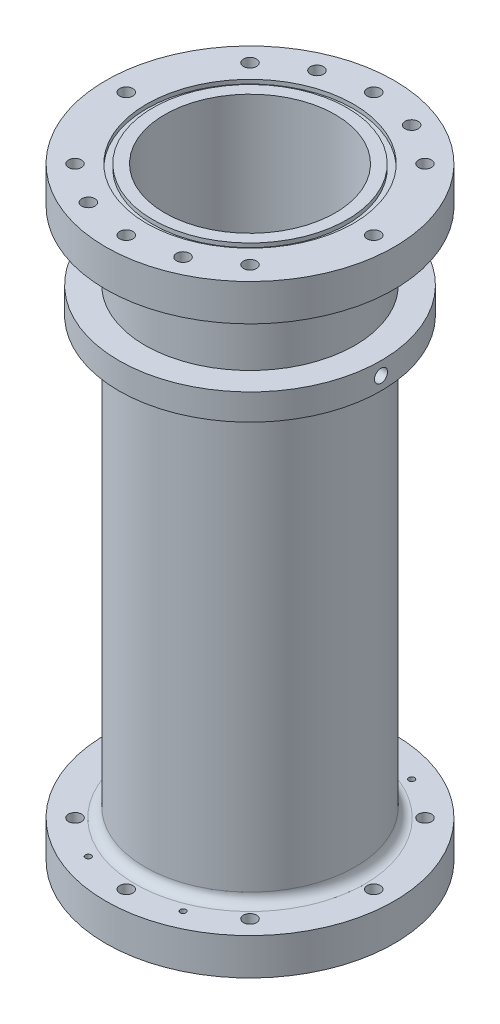
from build123d import *

# Parameters (mm, degrees)
SKETCH2_R               = 50.8
SKETCH2_R_2             = 41.275
BASE_CYLINDER_DEPTH     = 292.1
SKETCH3_R               = 69.85
SKETCH3_R_2             = 41.275
AFT_FLANGE_DEPTH        = 17.78
FORWARD_START           = -17.78
SKETCH4_R               = 69.85
SKETCH4_R_2             = 41.275
FORWARD_FLANGE_DEPTH    = 17.78
SKETCH6_R               = 50.0761
SKETCH6_R_2             = 47.0027
O_RING_SLOT_1_DEPTH     = 1.9812
O_RING_START            = -1.9812
SKETCH7_R               = 50.0761
SKETCH7_R_2             = 47.0027
O_RING_SLOT_2_DEPTH     = 1.9812
CUT_EXTRUDE4_DEPTH      = 309.351187771
CUT_EXTRUDE4_DEPTH_BACK = 309.351187771
SKETCH8_R               = 3.175
FILLET1_R               = 4.7625
SKETCH9_R               = 3.175
CUT_EXTRUDE5_DEPTH      = 7.62
CUT_EXTRUDE6_START      = -7.62
SKETCH10_R              = 3.175
CUT_EXTRUDE6_DEPTH      = 7.62
CUT_EXTRUDE7_REACH      = 303.143
SKETCH11_R              = 1.4097
CUT_EXTRUDE8_REACH      = 303.143
SKETCH12_R              = 1.4097
SKETCH14_R              = 63.5
SKETCH14_R_2            = 50.8
BOSS_EXTRUDE1_DEPTH     = 12.7
SKETCH16_R              = 3.175
CUT_EXTRUDE10_DEPTH     = 12.7
CUT_EXTRUDE11_START     = -12.7
SKETCH17_R              = 3.175
CUT_EXTRUDE11_DEPTH     = 12.7


with BuildPart() as part:
    # Sketch2 → Base Cylinder (new body)
    with BuildSketch(Plane(origin=(0, 0, 0), x_dir=(1, 0, 0), z_dir=(0, 1, 0))):
        Circle(SKETCH2_R)
        Circle(SKETCH2_R_2, mode=Mode.SUBTRACT)
    extrude(amount=BASE_CYLINDER_DEPTH)

    # Sketch3 → Aft Flange (add)
    with BuildSketch(Plane.XZ):
        Circle(SKETCH3_R)
        Circle(SKETCH3_R_2, mode=Mode.SUBTRACT)
    extrude(amount=-AFT_FLANGE_DEPTH)

    # Sketch4 → Forward Flange (add)
    with BuildSketch(Plane(origin=(0, 292.1, 0), x_dir=(1, 0, 0), z_dir=(0, 1, 0)).offset(FORWARD_START)):
        Circle(SKETCH4_R)
        Circle(SKETCH4_R_2, mode=Mode.SUBTRACT)
    extrude(amount=FORWARD_FLANGE_DEPTH)

    # Sketch6 → O-Ring Slot 1 (cut)
    with BuildSketch(Plane.XZ):
        Circle(SKETCH6_R)
        Circle(SKETCH6_R_2, mode=Mode.SUBTRACT)
    extrude(amount=-O_RING_SLOT_1_DEPTH, mode=Mode.SUBTRACT)

    # Sketch7 → O-Ring Slot 2 (cut)
    with BuildSketch(Plane(origin=(0, 292.1, 0), x_dir=(1, 0, 0), z_dir=(0, 1, 0)).offset(O_RING_START)):
        Circle(SKETCH7_R)
        Circle(SKETCH7_R_2, mode=Mode.SUBTRACT)
    extrude(amount=O_RING_SLOT_2_DEPTH, mode=Mode.SUBTRACT)

    # Sketch8 → Cut-Extrude4 (cut, two sides: drawn at the far end of the back side and taken through both)
    with BuildSketch(Plane.XZ.offset(-CUT_EXTRUDE4_DEPTH_BACK)):
        with Locations((-59.9186, 0)):
            Circle(SKETCH8_R)
        with Locations((-42.368848379, 42.368848379)):
            Circle(SKETCH8_R)
        with Locations((0, 59.9186)):
            Circle(SKETCH8_R)
        with Locations((42.368848379, 42.368848379)):
            Circle(SKETCH8_R)
        with Locations((59.9186, 0)):
            Circle(SKETCH8_R)
        with Locations((42.368848379, -42.368848379)):
            Circle(SKETCH8_R)
        with Locations((0, -59.9186)):
            Circle(SKETCH8_R)
        with Locations((-42.368848379, -42.368848379)):
            Circle(SKETCH8_R)
    extrude(amount=CUT_EXTRUDE4_DEPTH + CUT_EXTRUDE4_DEPTH_BACK, mode=Mode.SUBTRACT)

    # Fillet1
    fillet1_edges = [part.edges().sort_by_distance(p)[0] for p in [
        (-50.8, 17.78, 0),
        (-50.8, 274.32, 0),
    ]]
    fillet(fillet1_edges, radius=FILLET1_R)

    # Sketch9 → Cut-Extrude5 (cut)
    with BuildSketch(Plane(origin=(0, 292.1, 0), x_dir=(1, 0, 0), z_dir=(0, 1, 0))):
        with Locations((-22.929855511, 55.357568157)):
            Circle(SKETCH9_R)
        with Locations((22.929855511, -55.357568157)):
            Circle(SKETCH9_R)
        with Locations((22.929855511, 55.357568157)):
            Circle(SKETCH9_R)
        with Locations((-22.929855511, -55.357568157)):
            Circle(SKETCH9_R)
    extrude(amount=-CUT_EXTRUDE5_DEPTH, mode=Mode.SUBTRACT)

    # Sketch10 → Cut-Extrude6 (cut)
    with BuildSketch(Plane.XZ.offset(CUT_EXTRUDE6_START)):
        with Locations((-22.929855511, 55.357568157)):
            Circle(SKETCH10_R)
        with Locations((22.929855511, -55.357568157)):
            Circle(SKETCH10_R)
        with Locations((22.929855511, 55.357568157)):
            Circle(SKETCH10_R)
        with Locations((-22.929855511, -55.357568157)):
            Circle(SKETCH10_R)
    extrude(amount=CUT_EXTRUDE6_DEPTH, mode=Mode.SUBTRACT)

    # Sketch11 → Cut-Extrude7 (cut, up to next)
    with BuildSketch(Plane(origin=(0, 284.48, 0), x_dir=(1, 0, 0), z_dir=(0, 1, 0)), mode=Mode.PRIVATE) as cut_extrude7_sk1:
        with Locations((-22.929855511, 55.357568157)):
            Circle(SKETCH11_R)
    cut_extrude7_tool1 = extrude(cut_extrude7_sk1.sketch, amount=-CUT_EXTRUDE7_REACH, mode=Mode.PRIVATE) & part.part
    # Sketch11 → Cut-Extrude7 (cut, up to next)
    with BuildSketch(Plane(origin=(0, 284.48, 0), x_dir=(1, 0, 0), z_dir=(0, 1, 0)), mode=Mode.PRIVATE) as cut_extrude7_sk2:
        with Locations((22.929855511, 55.357568157)):
            Circle(SKETCH11_R)
    cut_extrude7_tool2 = extrude(cut_extrude7_sk2.sketch, amount=-CUT_EXTRUDE7_REACH, mode=Mode.PRIVATE) & part.part
    # Sketch11 → Cut-Extrude7 (cut, up to next)
    with BuildSketch(Plane(origin=(0, 284.48, 0), x_dir=(1, 0, 0), z_dir=(0, 1, 0)), mode=Mode.PRIVATE) as cut_extrude7_sk3:
        with Locations((-22.929855511, -55.357568157)):
            Circle(SKETCH11_R)
    cut_extrude7_tool3 = extrude(cut_extrude7_sk3.sketch, amount=-CUT_EXTRUDE7_REACH, mode=Mode.PRIVATE) & part.part
    # Sketch11 → Cut-Extrude7 (cut, up to next)
    with BuildSketch(Plane(origin=(0, 284.48, 0), x_dir=(1, 0, 0), z_dir=(0, 1, 0)), mode=Mode.PRIVATE) as cut_extrude7_sk4:
        with Locations((22.929855511, -55.357568157)):
            Circle(SKETCH11_R)
    cut_extrude7_tool4 = extrude(cut_extrude7_sk4.sketch, amount=-CUT_EXTRUDE7_REACH, mode=Mode.PRIVATE) & part.part
    add(cut_extrude7_tool1.solids().sort_by_distance((-22.929856, 284.48, -55.357568))[0], mode=Mode.SUBTRACT)
    add(cut_extrude7_tool2.solids().sort_by_distance((22.929856, 284.48, -55.357568))[0], mode=Mode.SUBTRACT)
    add(cut_extrude7_tool3.solids().sort_by_distance((-22.929856, 284.48, 55.357568))[0], mode=Mode.SUBTRACT)
    add(cut_extrude7_tool4.solids().sort_by_distance((22.929856, 284.48, 55.357568))[0], mode=Mode.SUBTRACT)

    # Sketch12 → Cut-Extrude8 (cut, up to next)
    with BuildSketch(Plane.XZ.offset(-7.62), mode=Mode.PRIVATE) as cut_extrude8_sk1:
        with Locations((-22.929855511, 55.357568157)):
            Circle(SKETCH12_R)
    cut_extrude8_tool1 = extrude(cut_extrude8_sk1.sketch, amount=-CUT_EXTRUDE8_REACH, mode=Mode.PRIVATE) & part.part
    # Sketch12 → Cut-Extrude8 (cut, up to next)
    with BuildSketch(Plane.XZ.offset(-7.62), mode=Mode.PRIVATE) as cut_extrude8_sk2:
        with Locations((22.929855511, 55.357568157)):
            Circle(SKETCH12_R)
    cut_extrude8_tool2 = extrude(cut_extrude8_sk2.sketch, amount=-CUT_EXTRUDE8_REACH, mode=Mode.PRIVATE) & part.part
    # Sketch12 → Cut-Extrude8 (cut, up to next)
    with BuildSketch(Plane.XZ.offset(-7.62), mode=Mode.PRIVATE) as cut_extrude8_sk3:
        with Locations((-22.929855511, -55.357568157)):
            Circle(SKETCH12_R)
    cut_extrude8_tool3 = extrude(cut_extrude8_sk3.sketch, amount=-CUT_EXTRUDE8_REACH, mode=Mode.PRIVATE) & part.part
    # Sketch12 → Cut-Extrude8 (cut, up to next)
    with BuildSketch(Plane.XZ.offset(-7.62), mode=Mode.PRIVATE) as cut_extrude8_sk4:
        with Locations((22.929855511, -55.357568157)):
            Circle(SKETCH12_R)
    cut_extrude8_tool4 = extrude(cut_extrude8_sk4.sketch, amount=-CUT_EXTRUDE8_REACH, mode=Mode.PRIVATE) & part.part
    add(cut_extrude8_tool1.solids().sort_by_distance((-22.929856, 7.62, 55.357568))[0], mode=Mode.SUBTRACT)
    add(cut_extrude8_tool2.solids().sort_by_distance((22.929856, 7.62, 55.357568))[0], mode=Mode.SUBTRACT)
    add(cut_extrude8_tool3.solids().sort_by_distance((-22.929856, 7.62, -55.357568))[0], mode=Mode.SUBTRACT)
    add(cut_extrude8_tool4.solids().sort_by_distance((22.929856, 7.62, -55.357568))[0], mode=Mode.SUBTRACT)

    # Sketch14 → Boss-Extrude1 (add)
    with BuildSketch(Plane(origin=(0, 228.6, 0), x_dir=(1, 0, 0), z_dir=(0, 1, 0))):
        Circle(SKETCH14_R)
        Circle(SKETCH14_R_2, mode=Mode.SUBTRACT)
    extrude(amount=BOSS_EXTRUDE1_DEPTH)

    # Sketch16 → Cut-Extrude10 (cut)
    with BuildSketch(Plane(origin=(-63.5, 0, 0), x_dir=(0, 0, -1), z_dir=(1, 0, 0))):
        with Locations((0, 234.95)):
            Circle(SKETCH16_R)
    extrude(amount=CUT_EXTRUDE10_DEPTH, mode=Mode.SUBTRACT)

    # Sketch17 → Cut-Extrude11 (cut)
    with BuildSketch(Plane(origin=(63.5, 0, 0), x_dir=(0, 0, -1), z_dir=(1, 0, 0)).offset(CUT_EXTRUDE11_START)):
        with Locations((0, 234.95)):
            Circle(SKETCH17_R)
    extrude(amount=CUT_EXTRUDE11_DEPTH, mode=Mode.SUBTRACT)


solid = part.part
